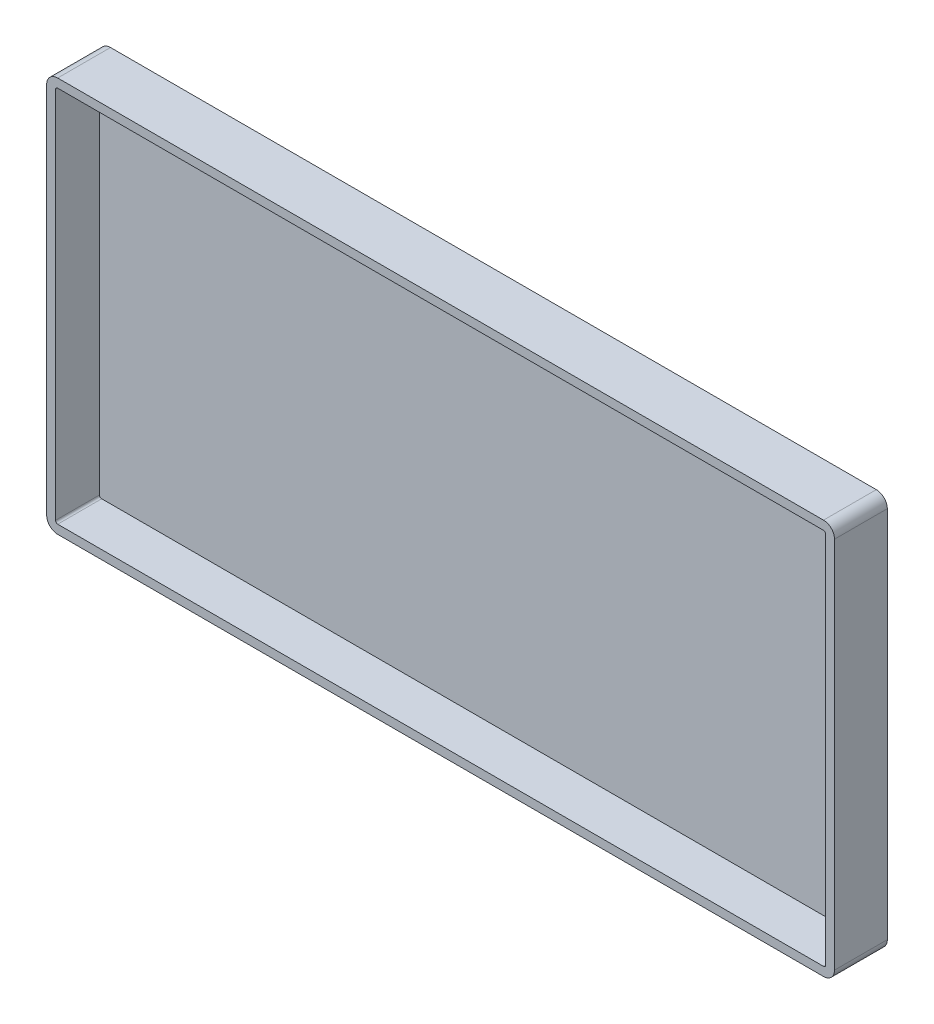
from build123d import *

# Parameters (mm, degrees)
THICKEN1_START   = -2
THICKEN1_DEPTH   = 2
THICKEN1_2_DEPTH = 10


# Read off the part's stored shape, not the designer's step: Thicken1
with BuildPart() as part:
    # Thicken1 outline → Thicken1 (new body)
    with BuildSketch(Plane.XY.offset(THICKEN1_START)):
        with BuildLine():
            Line((-87, -44.9), (87, -44.9))
            ThreePointArc((87, -44.9), (88.767766953, -44.167766953), (89.5, -42.4))
            Line((89.5, -42.4), (89.5, 42.4))
            ThreePointArc((89.5, 42.4), (88.767766953, 44.167766953), (87, 44.9))
            Line((87, 44.9), (-87, 44.9))
            ThreePointArc((-87, 44.9), (-88.767766953, 44.167766953), (-89.5, 42.4))
            Line((-89.5, 42.4), (-89.5, -42.4))
            ThreePointArc((-89.5, -42.4), (-88.767766953, -44.167766953), (-87, -44.9))
        make_face()
    extrude(amount=THICKEN1_DEPTH)

    # Thicken1 2 outline → Thicken1 2 (add)
    with BuildSketch(Plane.XY):
        with BuildLine():
            Line((-87, -44.9), (87, -44.9))
            ThreePointArc((87, -44.9), (88.767766953, -44.167766953), (89.5, -42.4))
            Line((89.5, -42.4), (89.5, 42.4))
            ThreePointArc((89.5, 42.4), (88.767766953, 44.167766953), (87, 44.9))
            Line((87, 44.9), (-87, 44.9))
            ThreePointArc((-87, 44.9), (-88.767766953, 44.167766953), (-89.5, 42.4))
            Line((-89.5, 42.4), (-89.5, -42.4))
            ThreePointArc((-89.5, -42.4), (-88.767766953, -44.167766953), (-87, -44.9))
        make_face()
        with BuildLine():
            ThreePointArc((87.5, -42.4), (87.353553391, -42.753553391), (87, -42.9))
            Line((87, -42.9), (-87, -42.9))
            ThreePointArc((-87, -42.9), (-87.353553391, -42.753553391), (-87.5, -42.4))
            Line((-87.5, -42.4), (-87.5, 42.4))
            ThreePointArc((-87.5, 42.4), (-87.353553391, 42.753553391), (-87, 42.9))
            Line((-87, 42.9), (87, 42.9))
            ThreePointArc((87, 42.9), (87.353553391, 42.753553391), (87.5, 42.4))
            Line((87.5, 42.4), (87.5, -42.4))
        make_face(mode=Mode.SUBTRACT)
    extrude(amount=THICKEN1_2_DEPTH)


solid = part.part
